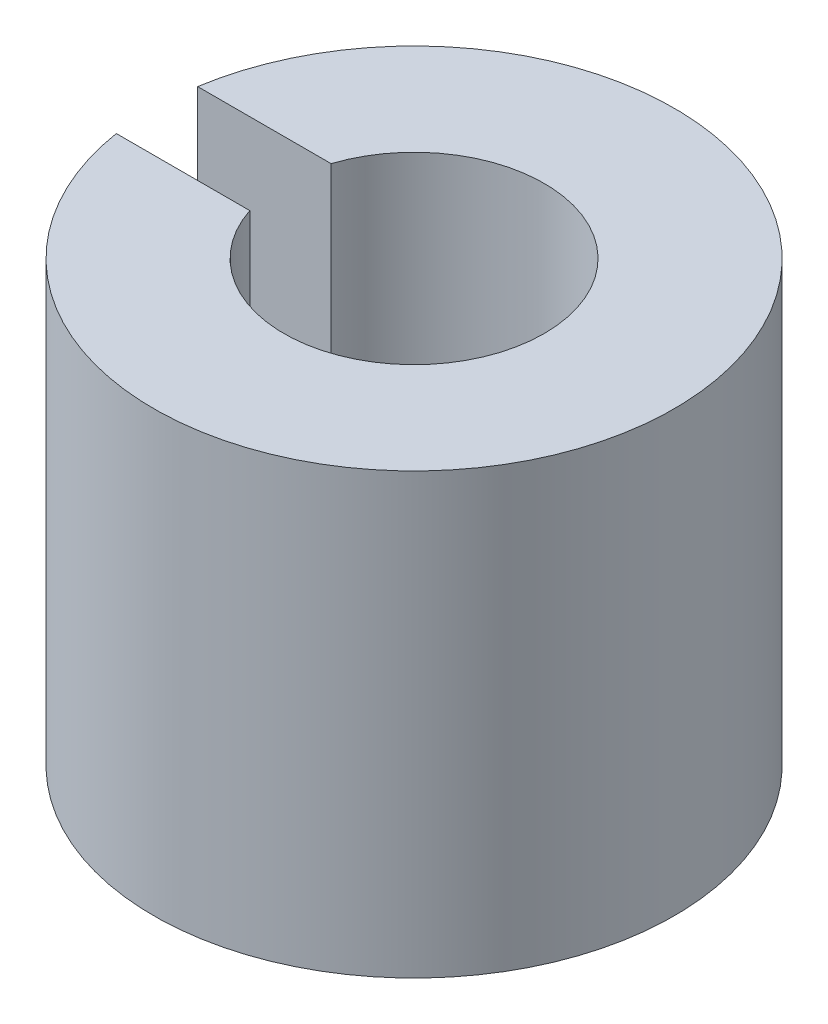
from build123d import *

# Parameters (mm, degrees)
SKETCH1_R           = 10.16
SKETCH1_R_2         = 5.08
BOSS_EXTRUDE1_DEPTH = 17.145
CUT_EXTRUDE2_REACH  = 24.37
SKETCH3_W           = 3.175
SKETCH3_H           = 17.145


with BuildPart() as part:
    # Sketch1 → Boss-Extrude1 (new body)
    with BuildSketch(Plane(origin=(0, 0, 0), x_dir=(1, 0, 0), z_dir=(0, 1, 0))):
        Circle(SKETCH1_R)
        Circle(SKETCH1_R_2, mode=Mode.SUBTRACT)
    extrude(amount=BOSS_EXTRUDE1_DEPTH)

    # Sketch3 → Cut-Extrude2 (cut, up to next)
    with BuildSketch(Plane(origin=(0, 0, 0), x_dir=(0, 0, -1), z_dir=(1, 0, 0)), mode=Mode.PRIVATE) as cut_extrude2_sk1:
        with Locations((0, 8.5725)):
            Rectangle(SKETCH3_W, SKETCH3_H)
    cut_extrude2_tool1 = extrude(cut_extrude2_sk1.sketch, amount=-CUT_EXTRUDE2_REACH, mode=Mode.PRIVATE) & part.part
    add(cut_extrude2_tool1.solids().sort_by_distance((0, 8.5725, 0))[0], mode=Mode.SUBTRACT)


solid = part.part
